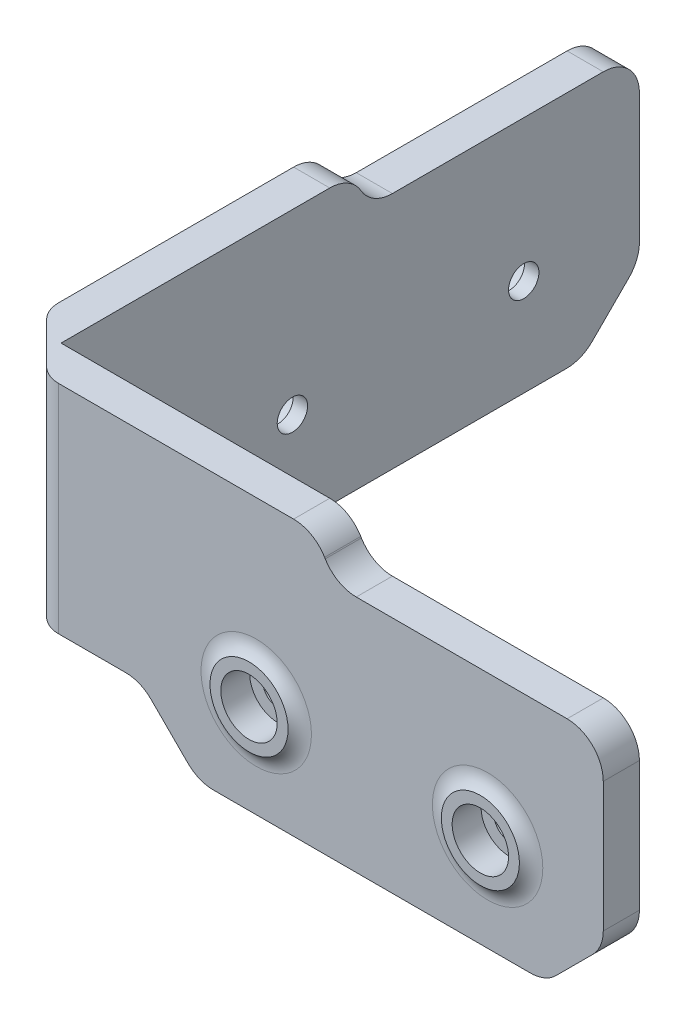
from build123d import *

# Parameters (mm, degrees)
BOSS_EXTRUDE1_DEPTH = 5
FILLET1_R           = 5
CHAMFER1_SIZE       = 8
FILLET2_R           = 4
SKETCH2_R           = 2.1
CUT_EXTRUDE1_DEPTH  = 271.24803422
SKETCH3_R           = 3.9
CUT_EXTRUDE2_DEPTH  = 3
BOSS_EXTRUDE2_START = 1
SKETCH4_R           = 5.4
SKETCH4_R_2         = 3.9
BOSS_EXTRUDE2_DEPTH = 1
FILLET3_R           = 3


with BuildPart() as part:
    # Sketch1 → Boss-Extrude1 (new body)
    with BuildSketch(Plane.XY):
        Polygon((-255, 28), (-255, -2), (-234, -2), (-226, -10), (-178, -10), (-170, -2), (-170, 23), (-207, 23), (-210, 28), align=None)
    boss_extrude1 = extrude(amount=BOSS_EXTRUDE1_DEPTH)

    # Mirror1: Boss-Extrude1 across plane
    add(boss_extrude1.mirror(Plane(origin=(-125, 0, -125), x_dir=(-0.7071067811865489, 0, 0.7071067811865462), z_dir=(-0.7071067811865464, 0, -0.7071067811865488))))

    # Fillet1
    fillet1_edges = [part.edges().sort_by_distance(p)[0] for p in [
        (-210, 28, 2.5),
        (-207, 23, 2.5),
        (-170, 23, 2.5),
        (-170, -2, 2.5),
        (-178, -10, 2.5),
        (-226, -10, 2.5),
        (-234, -2, 2.5),
        (-252.5, -2, -16),
        (-252.5, 28, -40),
        (-252.5, 23, -43),
        (-252.5, 23, -80),
        (-252.5, -2, -80),
        (-252.5, -10, -72),
        (-252.5, -10, -24),
    ]]
    fillet(fillet1_edges, radius=FILLET1_R)

    # Chamfer1
    chamfer1_edges = [part.edges().sort_by_distance(p)[0] for p in [
        (-255, 13, 5),
    ]]
    chamfer(chamfer1_edges, length=CHAMFER1_SIZE)

    # Fillet2
    fillet2_edges = [part.edges().sort_by_distance(p)[0] for p in [
        (-247, 13, 5),
        (-255, 13, -3),
    ]]
    fillet(fillet2_edges, radius=FILLET2_R)

    # Sketch2 → Cut-Extrude1 (cut, through all)
    with BuildSketch(Plane.XY.offset(5)):
        with Locations((-218, 3.425126266)):
            Circle(SKETCH2_R)
        with Locations((-186, 3.425126266)):
            Circle(SKETCH2_R)
    cut_extrude1 = extrude(amount=-CUT_EXTRUDE1_DEPTH, mode=Mode.SUBTRACT)

    # Sketch3 → Cut-Extrude2 (cut)
    with BuildSketch(Plane.XY.offset(5)):
        with Locations((-218, 3.425126266)):
            Circle(SKETCH3_R)
        with Locations((-186, 3.425126266)):
            Circle(SKETCH3_R)
    cut_extrude2 = extrude(amount=-CUT_EXTRUDE2_DEPTH, mode=Mode.SUBTRACT)

    # Sketch4 → Boss-Extrude2 (add)
    # profile 1 of 2: a face of its own
    with BuildSketch(Plane.XY.offset(5).offset(BOSS_EXTRUDE2_START)):
        with Locations((-218, 3.425126266)):
            Circle(SKETCH4_R)
        with Locations((-218, 3.425126266)):
            Circle(SKETCH4_R_2, mode=Mode.SUBTRACT)
    # profile 2 of 2: a face of its own
    with BuildSketch(Plane.XY.offset(5).offset(BOSS_EXTRUDE2_START)):
        with Locations((-186, 3.425126266)):
            Circle(SKETCH4_R)
        with Locations((-186, 3.425126266)):
            Circle(SKETCH4_R_2, mode=Mode.SUBTRACT)
    boss_extrude2 = extrude(amount=-BOSS_EXTRUDE2_DEPTH)

    # Mirror2: Cut-Extrude1, Cut-Extrude2, Boss-Extrude2 across plane
    add(cut_extrude1.mirror(Plane(origin=(-125, 0, -125), x_dir=(-0.7071067811865489, 0, 0.7071067811865462), z_dir=(-0.7071067811865464, 0, -0.7071067811865488))), mode=Mode.SUBTRACT)
    add(cut_extrude2.mirror(Plane(origin=(-125, 0, -125), x_dir=(-0.7071067811865489, 0, 0.7071067811865462), z_dir=(-0.7071067811865464, 0, -0.7071067811865488))), mode=Mode.SUBTRACT)
    add(boss_extrude2.mirror(Plane(origin=(-125, 0, -125), x_dir=(-0.7071067811865489, 0, 0.7071067811865462), z_dir=(-0.7071067811865464, 0, -0.7071067811865488))))

    # Fillet3
    # the kernel refuses this fillet: 3 mm, written as the material it adds along each edge
    with BuildSketch(Plane(origin=(-218, 3.425126266, 5), x_dir=(1, 0, 0), z_dir=(0, -1, 0))) as fillet3_piece_1:
        with BuildLine():
            CenterArc((7.636067977, 3), FILLET3_R, 221.810314896, 48.189685104)
            Line((5.4, 1), (5.35527864, 0.96))
            ThreePointArc((5.35527864, 0.96), (5.34, 0.5), (5.34, 0))
            Line((5.34, 0), (5.4, -0.06))
            Line((5.4, -0.06), (7.636067977, -0.06))
            Line((7.636067977, -0.06), (7.636067977, 0))
        make_face()
    revolve(axis=Axis((-218, 3.425126266, 5), (0, 0, 1)))
    with BuildSketch(Plane(origin=(-186, 3.425126266, 5), x_dir=(1, 0, 0), z_dir=(0, -1, 0))) as fillet3_piece_2:
        with BuildLine():
            CenterArc((7.636067977, 3), FILLET3_R, 221.810314896, 48.189685104)
            Line((7.636067977, 0), (7.636067977, -0.06))
            Line((7.636067977, -0.06), (5.4, -0.06))
            Line((5.4, -0.06), (5.34, 0))
            ThreePointArc((5.34, 0), (5.34, 0.5), (5.35527864, 0.96))
            Line((5.35527864, 0.96), (5.4, 1))
        make_face()
    revolve(axis=Axis((-186, 3.425126266, 5), (0, 0, 1)))
    with BuildSketch(Plane(origin=(-255, 3.425126266, -32), x_dir=(0, 0, -1), z_dir=(0, -1, 0))) as fillet3_piece_3:
        with BuildLine():
            CenterArc((7.636067977, -3), FILLET3_R, 90, 48.189685104)
            Line((5.4, -1), (5.35527864, -0.96))
            ThreePointArc((5.35527864, -0.96), (5.34, -0.5), (5.34, 0))
            Line((5.34, 0), (5.4, 0.06))
            Line((5.4, 0.06), (7.636067977, 0.06))
            Line((7.636067977, 0.06), (7.636067977, 0))
        make_face()
    revolve(axis=Axis((-255, 3.425126266, -32), (1, 0, 0)))
    with BuildSketch(Plane(origin=(-255, 3.425126266, -64), x_dir=(0, 0, -1), z_dir=(0, -1, 0))) as fillet3_piece_4:
        with BuildLine():
            CenterArc((7.636067977, -3), FILLET3_R, 90, 48.189685104)
            Line((5.4, -1), (5.35527864, -0.96))
            ThreePointArc((5.35527864, -0.96), (5.34, -0.5), (5.34, 0))
            Line((5.34, 0), (5.4, 0.06))
            Line((5.4, 0.06), (7.636067977, 0.06))
            Line((7.636067977, 0.06), (7.636067977, 0))
        make_face()
    revolve(axis=Axis((-255, 3.425126266, -64), (1, 0, 0)))


solid = part.part
